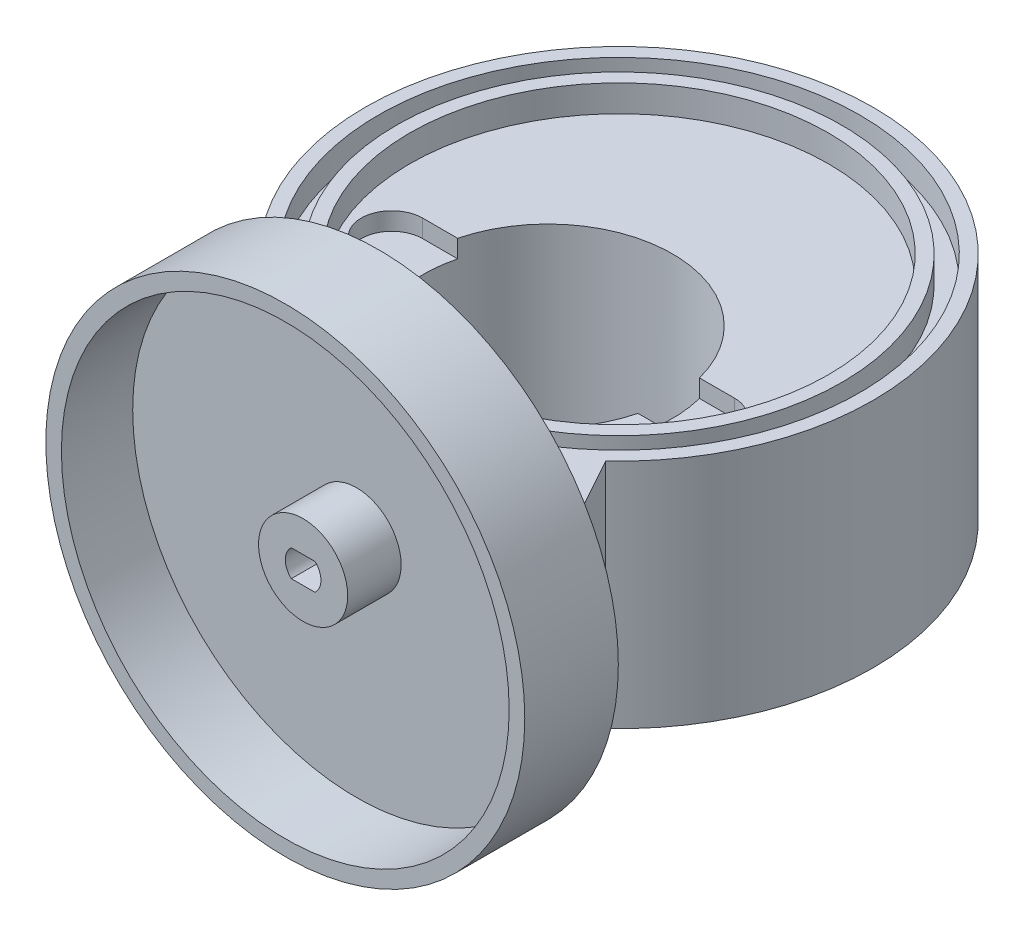
from build123d import *

# Parameters (mm, degrees)
SKETCH1_R                = 28.5
BOSS_EXTRUDE1_DEPTH      = 3
BOSS_EXTRUDE4_DEPTH      = 20
BOSS_EXTRUDE7_DEPTH      = 3
SKETCH7_R                = 27
SKETCH7_R_2              = 25
CUT_EXTRUDE1_DEPTH       = 3
CUT_EXTRUDE2_START       = -5
CUT_EXTRUDE2_DEPTH       = 5
CUT_EXTRUDE3_START       = -5
CUT_EXTRUDE3_DEPTH       = 5
BOSS_EXTRUDE8_DEPTH      = 2
BOSS_EXTRUDE8_DEPTH_BACK = 0.5
SKETCH10_R               = 26.875
CHAMFER1_SIZE            = 13.49895933
BOSS_EXTRUDE9_START      = 8
SKETCH11_R               = 26.875
SKETCH11_R_2             = 25.125
BOSS_EXTRUDE9_DEPTH      = 8
CUT_EXTRUDE4_START       = -2
CUT_EXTRUDE4_DEPTH       = 2
SKETCH12_R               = 5
BOSS_EXTRUDE10_DEPTH     = 6
CUT_EXTRUDE5_DEPTH       = 6


with BuildPart() as part:
    # Sketch1 → Boss-Extrude1 (new body)
    with BuildSketch(Plane(origin=(0, 0, 0), x_dir=(1, 0, 0), z_dir=(0, 1, 0))):
        with Locations(Location((0, 0, 0), (0, 0, 270))):
            Circle(SKETCH1_R)
    extrude(amount=BOSS_EXTRUDE1_DEPTH)

    # Sketch2 → Boss-Extrude4 (add)
    with BuildSketch(Plane(origin=(0, 3, 0), x_dir=(1, 0, 0), z_dir=(0, 1, 0))):
        with BuildLine():
            Line((-9, -20.223805295), (-9, -18.723805295))
            ThreePointArc((-9, -18.723805295), (-11.855740218, -15.445899804), (-13.568253388, -11.45))
            ThreePointArc((-13.568253388, -11.45), (-14, -8), (-13.568253388, -4.55))
            ThreePointArc((-13.568253388, -4.55), (0, 6), (13.568253388, -4.55))
            ThreePointArc((13.568253388, -4.55), (14, -8), (13.568253388, -11.45))
            ThreePointArc((13.568253388, -11.45), (11.855740218, -15.445899804), (9, -18.723805295))
            Line((9, -18.723805295), (9, -20.223805295))
            Line((9, -20.223805295), (7.35, -22))
            Line((7.35, -22), (7.617272727, -27.463196394))
            ThreePointArc((7.617272727, -27.463196394), (22.686364547, -17.250474302), (28.5, 0))
            ThreePointArc((28.5, 0), (-17.250474302, 22.686364547), (-7.617272727, -27.463196394))
            Line((-7.617272727, -27.463196394), (-7.35, -22))
            Line((-7.35, -22), (-9, -20.223805295))
        make_face()
    extrude(amount=BOSS_EXTRUDE4_DEPTH)

    # Boss-Extrude7: read off the stored shape, not the designer's step
    # Boss-Extrude7 outline → Boss-Extrude7 (add)
    with BuildSketch(Plane(origin=(0, 23, 0), x_dir=(1, 0, 0), z_dir=(0, 1, 0))):
        with BuildLine():
            ThreePointArc((7.617272727, -27.463196394), (0, 28.5), (-7.617272727, -27.463196394))
            Line((-7.617272727, -27.463196394), (-7.542031899, -25.92523394))
            ThreePointArc((-7.542031899, -25.92523394), (0, 27), (7.542031899, -25.92523394))
            Line((7.542031899, -25.92523394), (7.617272727, -27.463196394))
        make_face()
        with BuildLine():
            ThreePointArc((7.441330866, -23.866851383), (0, 25), (-7.441330866, -23.866851383))
            Line((-7.441330866, -23.866851383), (-7.365455329, -22.315915124))
            ThreePointArc((-7.365455329, -22.315915124), (0, 23.5), (7.365455329, -22.315915124))
            Line((7.365455329, -22.315915124), (7.441330866, -23.866851383))
        make_face()
    extrude(amount=BOSS_EXTRUDE7_DEPTH)

    # Sketch7 → Cut-Extrude1 (cut)
    with BuildSketch(Plane.XZ):
        with Locations(Location((0, 0, 0), (0, 0, 270))):
            Circle(SKETCH7_R)
        with Locations(Location((0, 0, 0), (0, 0, 270))):
            Circle(SKETCH7_R_2, mode=Mode.SUBTRACT)
    extrude(amount=-CUT_EXTRUDE1_DEPTH, mode=Mode.SUBTRACT)

    # Sketch8 → Cut-Extrude2 (cut)
    with BuildSketch(Plane(origin=(0, 3, 0), x_dir=(1, 0, 0), z_dir=(0, 1, 0)).offset(CUT_EXTRUDE2_START)):
        with BuildLine():
            Line((-7.542031899, -25.92523394), (-7.617272727, -27.463196394))
            ThreePointArc((-7.617272727, -27.463196394), (0, -28.5), (7.617272727, -27.463196394))
            Line((7.617272727, -27.463196394), (7.542031899, -25.92523394))
            ThreePointArc((7.542031899, -25.92523394), (0, -27), (-7.542031899, -25.92523394))
        make_face()
    extrude(amount=CUT_EXTRUDE2_DEPTH, mode=Mode.SUBTRACT)

    # Sketch9 → Cut-Extrude3 (cut)
    with BuildSketch(Plane(origin=(0, 3, 0), x_dir=(1, 0, 0), z_dir=(0, 1, 0)).offset(CUT_EXTRUDE3_START)):
        with BuildLine():
            Line((-7.35, -22), (-7.441330866, -23.866851383))
            ThreePointArc((-7.441330866, -23.866851383), (0, -25), (7.441330866, -23.866851383))
            Line((7.441330866, -23.866851383), (7.35, -22))
            Line((7.35, -22), (9, -20.223805295))
            Line((9, -20.223805295), (9, -18.723805295))
            ThreePointArc((9, -18.723805295), (0, 6), (-9, -18.723805295))
            Line((-9, -18.723805295), (-9, -20.223805295))
            Line((-9, -20.223805295), (-7.35, -22))
        make_face()
    extrude(amount=CUT_EXTRUDE3_DEPTH, mode=Mode.SUBTRACT)

    # Sketch10 → Boss-Extrude8 (add, two sides: drawn at the far end of the back side and taken through both)
    with BuildSketch(Plane.XY.offset(27.463196394).offset(-BOSS_EXTRUDE8_DEPTH_BACK)):
        with Locations((0, 13)):
            Circle(SKETCH10_R)
    extrude(amount=BOSS_EXTRUDE8_DEPTH + BOSS_EXTRUDE8_DEPTH_BACK)

    # Chamfer1
    # the kernel refuses this chamfer: 13.49895933, 12 mm, written as the material it adds along each edge
    with BuildSketch(Plane(origin=(9.23233666, 23, 26.963196394), x_dir=(0.8582935658681564, 0, -0.5131589956235051), z_dir=(0, -1, 0))) as chamfer1_piece_1:
        with BuildLine():
            Line((11.824703255, 0), (CHAMFER1_SIZE * 0.85829356586, CHAMFER1_SIZE * 0.513158995619))
            Line((CHAMFER1_SIZE * 0.85829356586, CHAMFER1_SIZE * 0.513158995619), (0, 0))
            ThreePointArc((0, 0), (5.921946236, 0.620003797), (11.824703255, 0))
        make_face()
    extrude(amount=23)
    with BuildSketch(Plane(origin=(-9.23233666, 23, 26.963196394), x_dir=(-0.8582935658681565, 0, -0.5131589956235051), z_dir=(0, -1, 0))) as chamfer1_piece_2:
        with BuildLine():
            Line((11.824703255, 0), (CHAMFER1_SIZE * 0.85829356586, -CHAMFER1_SIZE * 0.513158995619))
            Line((CHAMFER1_SIZE * 0.85829356586, -CHAMFER1_SIZE * 0.513158995619), (0, 0))
            ThreePointArc((0, 0), (5.921946236, -0.620003797), (11.824703255, 0))
        make_face()
    extrude(amount=23)
    with BuildSketch(Plane(origin=(-9.232336658, 26, 26.963196394), x_dir=(-0.8582935658951355, 0, -0.5131589955783807), z_dir=(0, -1, 0))) as chamfer1_piece_3:
        with BuildLine():
            Line((11.824703255, 0), (CHAMFER1_SIZE * 0.858293565887, -CHAMFER1_SIZE * 0.513158995574))
            Line((CHAMFER1_SIZE * 0.858293565887, -CHAMFER1_SIZE * 0.513158995574), (0, 0))
            ThreePointArc((0, 0), (5.921946236, -0.620003797), (11.824703255, 0))
        make_face()
    extrude(amount=3)
    with BuildSketch(Plane(origin=(9.232336658, 26, 26.963196394), x_dir=(0.8582935658951357, 0, -0.5131589955783805), z_dir=(0, -1, 0))) as chamfer1_piece_4:
        with BuildLine():
            Line((11.824703255, 0), (CHAMFER1_SIZE * 0.858293565887, CHAMFER1_SIZE * 0.513158995574))
            Line((CHAMFER1_SIZE * 0.858293565887, CHAMFER1_SIZE * 0.513158995574), (0, 0))
            ThreePointArc((0, 0), (5.921946236, 0.620003797), (11.824703255, 0))
        make_face()
    extrude(amount=3)

    # Sketch11 → Boss-Extrude9 (add)
    with BuildSketch(Plane.XY.offset(29.463196394).offset(BOSS_EXTRUDE9_START)):
        with Locations((0, 13)):
            Circle(SKETCH11_R)
        with Locations((0, 13)):
            Circle(SKETCH11_R_2, mode=Mode.SUBTRACT)
    extrude(amount=-BOSS_EXTRUDE9_DEPTH)

    # Sketch13 → Cut-Extrude4 (cut)
    with BuildSketch(Plane(origin=(0, 23, 0), x_dir=(1, 0, 0), z_dir=(0, 1, 0)).offset(CUT_EXTRUDE4_START)):
        with BuildLine():
            Line((13.568253388, -11.45), (17.5, -11.45))
            ThreePointArc((17.5, -11.45), (20.95, -8), (17.5, -4.55))
            Line((17.5, -4.55), (13.568253388, -4.55))
            ThreePointArc((13.568253388, -4.55), (0, 6), (-13.568253388, -4.55))
            Line((-13.568253388, -4.55), (-17.5, -4.55))
            ThreePointArc((-17.5, -4.55), (-20.95, -8), (-17.5, -11.45))
            Line((-17.5, -11.45), (-13.568253388, -11.45))
            ThreePointArc((-13.568253388, -11.45), (-11.855740218, -15.445899804), (-9, -18.723805295))
            Line((-9, -18.723805295), (-9, -20.223805295))
            Line((-9, -20.223805295), (-7.35, -22))
            Line((-7.35, -22), (-7.35, -25))
            Line((-7.35, -25), (7.35, -25))
            Line((7.35, -25), (7.35, -22))
            Line((7.35, -22), (9, -20.223805295))
            Line((9, -20.223805295), (9, -18.723805295))
            ThreePointArc((9, -18.723805295), (11.855740218, -15.445899804), (13.568253388, -11.45))
        make_face()
    extrude(amount=CUT_EXTRUDE4_DEPTH, mode=Mode.SUBTRACT)

    # Sketch12 → Boss-Extrude10 (add)
    with BuildSketch(Plane.XY.offset(29.463196394)):
        with Locations((0, 13)):
            Circle(SKETCH12_R)
    extrude(amount=BOSS_EXTRUDE10_DEPTH)

    # Sketch14 → Cut-Extrude5 (cut)
    with BuildSketch(Plane.XY.offset(35.463196394)):
        with BuildLine():
            Line((-1.322875656, 11.5), (1.322875656, 11.5))
            ThreePointArc((1.322875656, 11.5), (2, 13), (1.322875656, 14.5))
            Line((1.322875656, 14.5), (-1.322875656, 14.5))
            ThreePointArc((-1.322875656, 14.5), (-2, 13), (-1.322875656, 11.5))
        make_face()
    extrude(amount=-CUT_EXTRUDE5_DEPTH, mode=Mode.SUBTRACT)


solid = part.part
